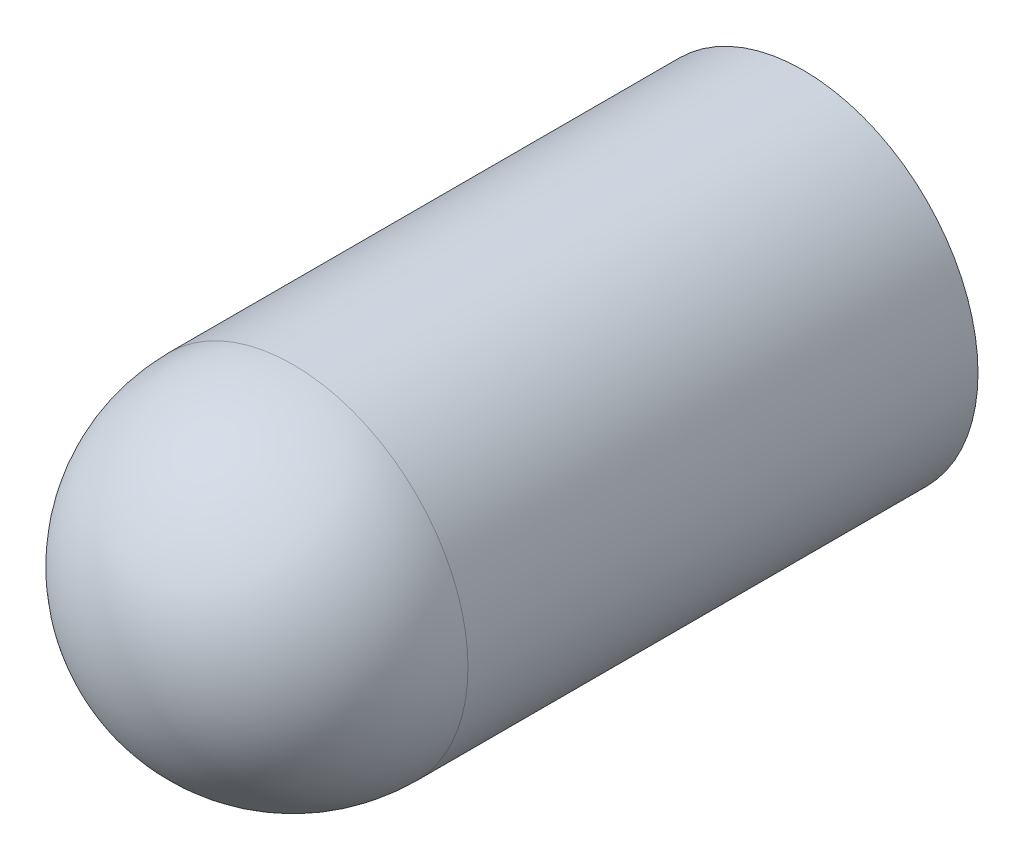
from build123d import *

# Parameters (mm, degrees)
SKETCH1_R           = 12
BOSS_EXTRUDE1_DEPTH = 35
DOME1_FACE_RADIUS   = 12
DOME1_HEIGHT        = 12


# Read off the part's stored shape, not the designer's step: Shell1
with BuildPart() as part:
    # Sketch1 → Boss-Extrude1 (new body)
    with BuildSketch(Plane.XY):
        Circle(SKETCH1_R)
    extrude(amount=BOSS_EXTRUDE1_DEPTH)

    # Dome1: a dome of height H over a round flat face of radius A is a cap of a sphere of radius (A * A + H * H) / (2 * H)
    dome1_r = (DOME1_FACE_RADIUS * DOME1_FACE_RADIUS + DOME1_HEIGHT * DOME1_HEIGHT) / (2 * DOME1_HEIGHT)
    dome1_base = Plane((0, 0, 35), z_dir=(0, 0, 1))
    with Locations(dome1_base.offset(DOME1_HEIGHT - dome1_r)):
        dome1_ball = Sphere(dome1_r, mode=Mode.PRIVATE)
    add(split(dome1_ball, bisect_by=dome1_base, keep=Keep.TOP, mode=Mode.PRIVATE))

    # Shell1 outline → Shell1 (revolve, cut)
    with BuildSketch(Plane.XZ):
        with BuildLine():
            Line((10.5, 1.5), (10.5, 34.999999989))
            ThreePointArc((10.5, 34.999999989), (7.424621206, 42.424621199), (0, 45.5))
            Line((0, 45.5), (0, 1.5))
            Line((0, 1.5), (10.5, 1.5))
        make_face()
    revolve(axis=Axis((0, 0, 0), (0, 0, 1)), mode=Mode.SUBTRACT)


solid = part.part
